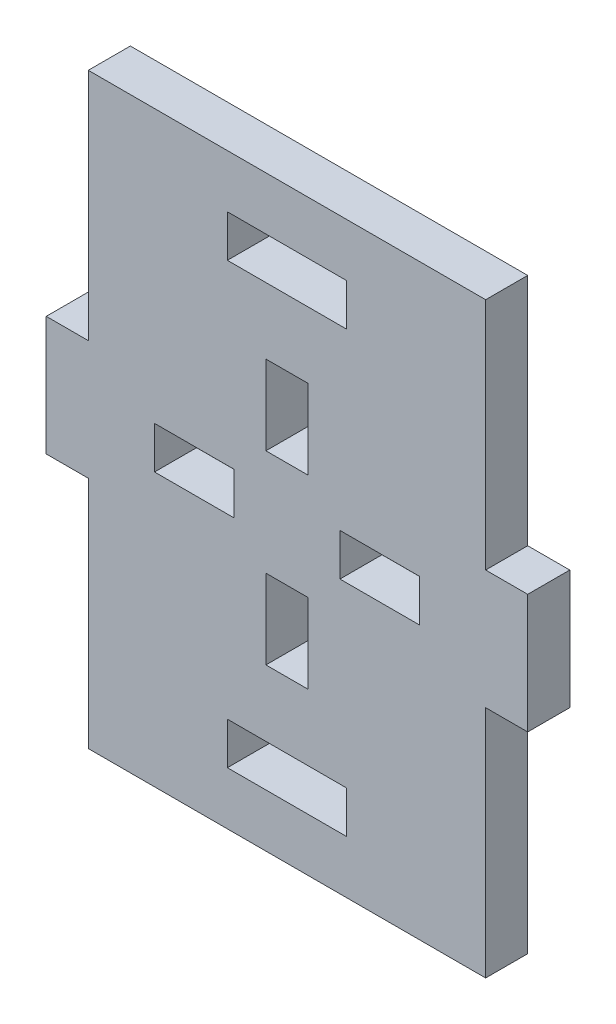
from build123d import *

# Parameters (mm, degrees)
BOSS_EXTRUDE1_DEPTH = 1.5875


with BuildPart() as part:
    # Sketch1 → Boss-Extrude1 (new, symmetric)
    with BuildSketch(Plane.XY):
        Polygon((0, 0), (0, 17.675), (3.175, 17.675), (3.175, 26.675), (0, 26.675), (0, 44.35), (-30, 44.35), (-30, 26.675), (-33.175, 26.675), (-33.175, 17.675), (-30, 17.675), (-30, 0), align=None)
        Polygon((-15, 4), (-10.5, 4), (-10.5, 7.175), (-19.5, 7.175), (-19.5, 4), align=None, mode=Mode.SUBTRACT)
        Polygon((-15, 12.175), (-13.41, 12.175), (-13.41, 18.175), (-16.59, 18.175), (-16.59, 12.175), align=None, mode=Mode.SUBTRACT)
        Polygon((-16.59, 32.175), (-15, 32.175), (-13.41, 32.175), (-13.41, 26.175), (-16.59, 26.175), align=None, mode=Mode.SUBTRACT)
        Polygon((-19.5, 40.35), (-15, 40.35), (-10.5, 40.35), (-10.5, 37.175), (-19.5, 37.175), align=None, mode=Mode.SUBTRACT)
        Polygon((-19, 22.175), (-19, 23.765), (-25, 23.765), (-25, 20.585), (-19, 20.585), align=None, mode=Mode.SUBTRACT)
        Polygon((-11, 20.585), (-11, 22.175), (-11, 23.765), (-5, 23.765), (-5, 20.585), align=None, mode=Mode.SUBTRACT)
    extrude(amount=BOSS_EXTRUDE1_DEPTH, both=True)


solid = part.part
